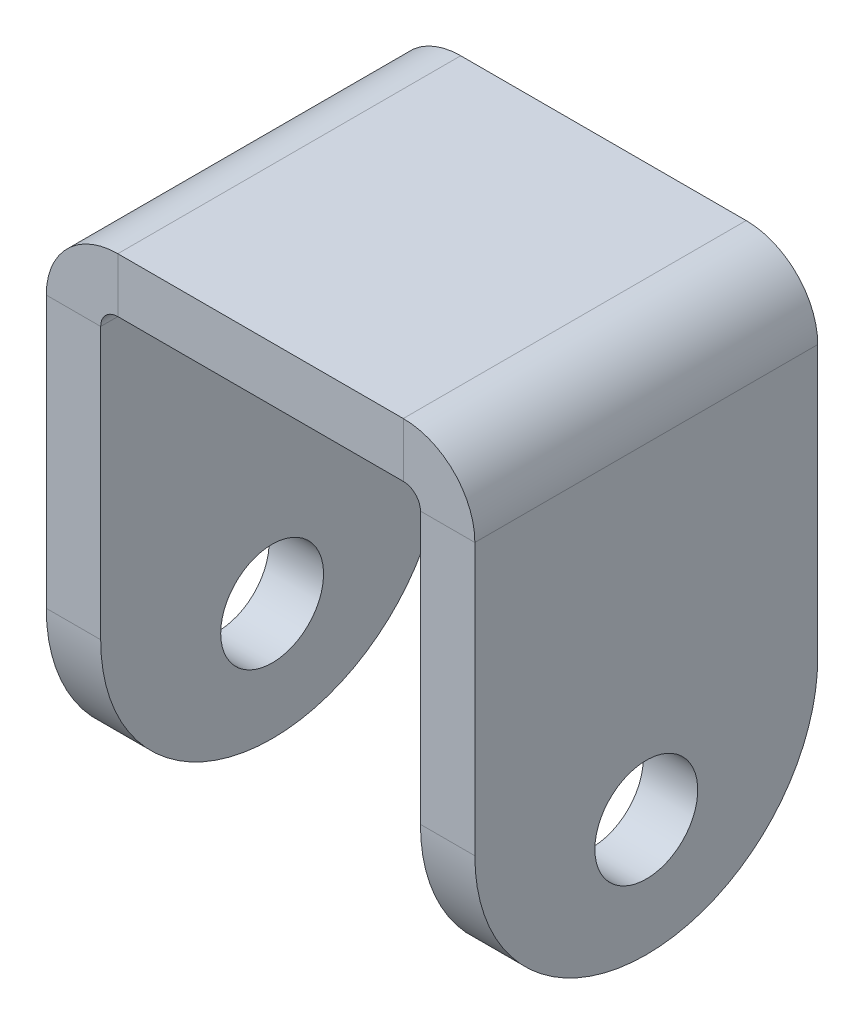
from build123d import *

# Parameters (mm, degrees)
BASE_FLANGE1_DEPTH = 20
SKETCH6_R          = 3
CUT_EXTRUDE1_DEPTH = 44.874821937
FILLET1_R          = 10


# Read off the part's stored shape, not the designer's step: Base-Flange1
with BuildPart() as part:
    # Base-Flange1 outline → Base-Flange1 (new body)
    with BuildSketch(Plane.XY):
        with BuildLine():
            Line((21.825, 25.825), (21.825, 0))
            Line((21.825, 0), (25, 0))
            Line((25, 0), (25, 25.825))
            ThreePointArc((25, 25.825), (23.777170811, 28.777170811), (20.825, 30))
            Line((20.825, 30), (4.175, 30))
            ThreePointArc((4.175, 30), (1.222829189, 28.777170811), (0, 25.825))
            Line((0, 25.825), (0, 0))
            Line((0, 0), (3.175, 0))
            Line((3.175, 0), (3.175, 25.825))
            ThreePointArc((3.175, 25.825), (3.467893219, 26.532106781), (4.175, 26.825))
            Line((4.175, 26.825), (20.825, 26.825))
            ThreePointArc((20.825, 26.825), (21.532106781, 26.532106781), (21.825, 25.825))
        make_face()
    extrude(amount=BASE_FLANGE1_DEPTH)

    # Sketch6 → Cut-Extrude1 (cut, through all)
    with BuildSketch(Plane.ZY):
        with Locations((10, 6.825)):
            Circle(SKETCH6_R)
    extrude(amount=-CUT_EXTRUDE1_DEPTH, mode=Mode.SUBTRACT)

    # Fillet1
    fillet1_edges = [part.edges().sort_by_distance(p)[0] for p in [
        (23.4125, 0, 20),
        (23.4125, 0, 0),
        (1.5875, 0, 0),
        (1.5875, 0, 20),
    ]]
    fillet(fillet1_edges, radius=FILLET1_R - 0.0001)  # a hair under: the kernel refuses the full size


solid = part.part
